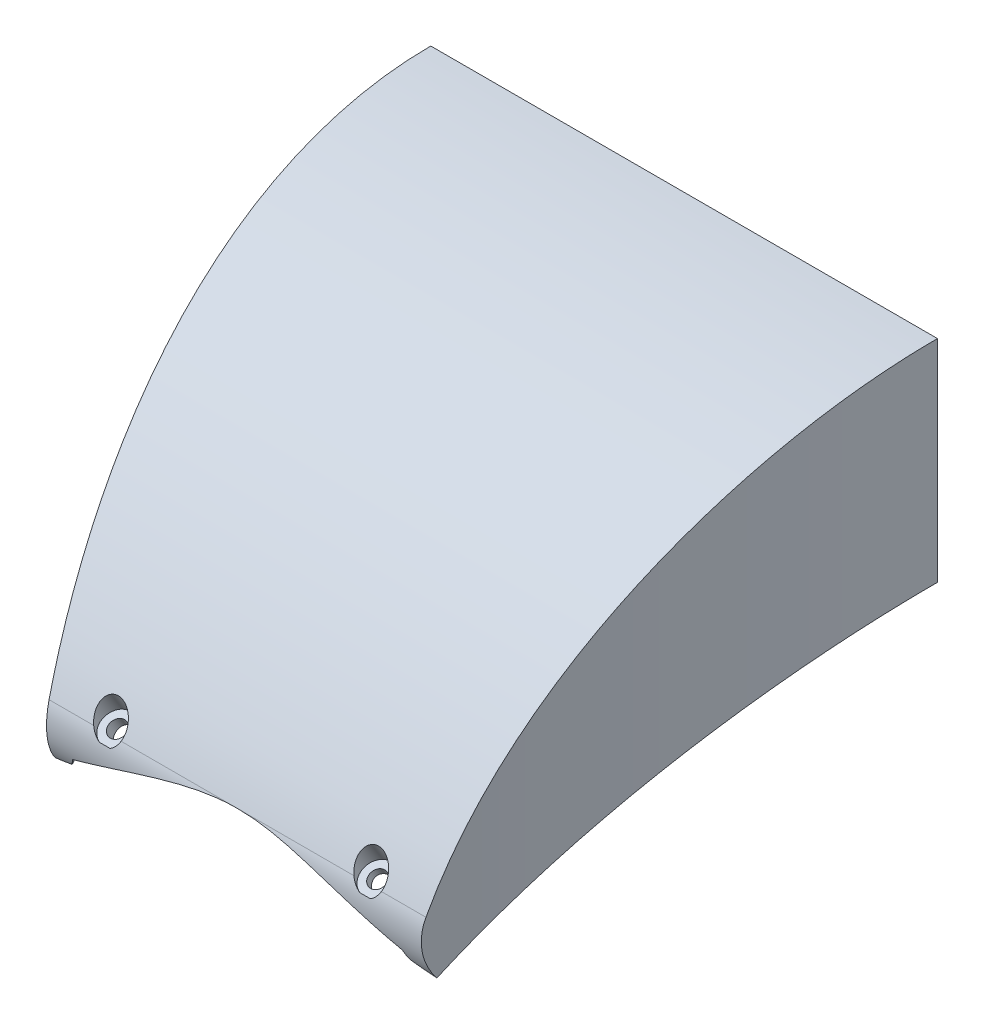
from build123d import *

# Parameters (mm, degrees)
TOP_CUT_DEPTH                   = 223.111574312
TOP_CUT_DEPTH_BACK              = 223.111574312
SIDE_CUT_DEPTH                  = 196.608334623
SIDE_CUT_DEPTH_BACK             = 196.608334623
BOTTOM_CUT_REACH                = 196.677
BOTTOM_CUT_END_RADIUS           = 109.850014385
HOLE_START                      = -57.000000101
HOLE_TABS_DEPTH                 = 114.000000101
HOLE_START_2                    = 107.658333008
HOLE_TABS_2_DEPTH               = 38.341666992
SKETCH9_R                       = 2
REAR_HOLES_DEPTH                = 138.05974715
FRONT_HOLES_DEPTH               = 101.36697221
FRONT_HOLES_DEPTH_BACK          = 101.36697221
SKETCH13_R                      = 2
BOSS_EXTRUDE1_REACH             = 196.677
BOSS_EXTRUDE1_DIRECTION_2_REACH = 196.677
CUT_EXTRUDE30_DEPTH             = 195.677019765
CUT_EXTRUDE30_DEPTH_BACK        = 195.677019765
SKETCH17_R                      = 3.75
CUT_EXTRUDE31_DEPTH             = 100.46511077


with BuildPart() as part:
    # Body: sweep along a path in Sketch4
    with BuildLine(Plane(origin=(-60, 0, 0), x_dir=(0, 1, 0), z_dir=(-1, 0, 0))) as body_path:
        ThreePointArc((98.107084352, 0), (82.178849239, -63.884661696), (38.123020423, -112.81361653))
    # Sketch3 → Body (sweep)
    with BuildSketch(Plane.XY):
        with BuildLine():
            Line((-40, 107.819293264), (-39, 109.778185447))
            ThreePointArc((-39, 109.778185447), (0, 116.5), (39, 109.778185447))
            Line((39, 109.778185447), (40, 107.819293264))
            ThreePointArc((40, 107.819293264), (50.235264013, 103.447659468), (60, 98.107084352))
            Line((60, 98.107084352), (60, 148.107084352))
            Line((60, 148.107084352), (-60, 148.107084352))
            Line((-60, 148.107084352), (-60, 98.107084352))
            ThreePointArc((-60, 98.107084352), (-50.235264013, 103.447659468), (-40, 107.819293264))
        make_face()
    sweep(path=body_path.line)

    # Sketch5 → Top Cut (cut, two sides: drawn at the far end of the back side and taken through both)
    with BuildSketch(Plane.ZY.offset(-TOP_CUT_DEPTH_BACK)):
        with BuildLine():
            Line((154.265495158, 66.082665596), (112.81361653, 38.123020423))
            ThreePointArc((112.81361653, 38.123020423), (78.777227663, 116.060994057), (0, 148.107084352))
            ThreePointArc((0, 148.107084352), (87.358239835, 126.326228882), (154.265495158, 66.082665596))
        make_face()
    extrude(amount=TOP_CUT_DEPTH + TOP_CUT_DEPTH_BACK, mode=Mode.SUBTRACT)

    # Sketch6 → Side Cut (cut, two sides: drawn at the far end of the back side and taken through both)
    with BuildSketch(Plane(origin=(0, 0, 0), x_dir=(1, 0, 0), z_dir=(0, 1, 0)).offset(-SIDE_CUT_DEPTH_BACK)):
        with BuildLine():
            Line((-60, 0), (-60, -115.81361653))
            Line((-60, -115.81361653), (-41.487311586, -115.81361653))
            ThreePointArc((-41.487311586, -115.81361653), (-55.342635269, -58.641950441), (-60, 0))
        make_face()
        with BuildLine():
            Line((60, -115.81361653), (41.487311586, -115.81361653))
            ThreePointArc((41.487311586, -115.81361653), (55.342635269, -58.641950441), (60, 0))
            Line((60, 0), (60, -115.81361653))
        make_face()
    extrude(amount=SIDE_CUT_DEPTH + SIDE_CUT_DEPTH_BACK, mode=Mode.SUBTRACT)

    # Bottom Cut: up to this cylinder (the profile starts inside it)
    bottom_cut_end = Plane(origin=(0, 35.257069967, 0), z_dir=(1, 0, 0)) * Cylinder(BOTTOM_CUT_END_RADIUS, 614.054028769, mode=Mode.PRIVATE)
    # Sketch7 → Bottom Cut (cut, up to the surface)
    with BuildSketch(Plane(origin=(0, 0, 0), x_dir=(1, 0, 0), z_dir=(0, 1, 0)), mode=Mode.PRIVATE) as bottom_cut_sk1:
        with BuildLine():
            Line((-43, 0), (43, 0))
            Line((43, 0), (43, -10))
            Line((43, -10), (56.86429563, -10))
            ThreePointArc((56.86429563, -10), (53.132112911, -53.252179765), (44.339363468, -95.765328314))
            Line((44.339363468, -95.765328314), (-44.339363468, -95.765328314))
            ThreePointArc((-44.339363468, -95.765328314), (-53.132112911, -53.252179765), (-56.86429563, -10))
            Line((-56.86429563, -10), (-43, -10))
            Line((-43, -10), (-43, 0))
        make_face()
    bottom_cut_tool1 = extrude(bottom_cut_sk1.sketch, amount=BOTTOM_CUT_REACH, mode=Mode.PRIVATE) & bottom_cut_end
    add(bottom_cut_tool1.solids().sort_by_distance((0, 0, 47.139148))[0], mode=Mode.SUBTRACT)

    # Hole Tabs: read off the stored shape, not the designer's step
    # Hole Tabs outline → Hole Tabs (cut)
    with BuildSketch(Plane(origin=(0, 0, 0), x_dir=(0, 0, -1), z_dir=(1, 0, 0)).offset(HOLE_START)):
        with BuildLine():
            Line((-10, 107.658333008), (0, 107.658333008))
            Line((0, 107.658333008), (0, 145.107084352))
            ThreePointArc((0, 145.107084352), (-5.005198275, 144.992996858), (-10, 144.650971353))
            Line((-10, 144.650971353), (-10, 107.658333008))
        make_face()
    extrude(amount=HOLE_TABS_DEPTH, mode=Mode.SUBTRACT)

    # Hole Tabs 2 outline → Hole Tabs 2 (add)
    with BuildSketch(Plane(origin=(0, 0, 0), x_dir=(1, 0, 0), z_dir=(0, 1, 0)).offset(HOLE_START_2)):
        with BuildLine():
            Line((-57.000000101, -10), (-56.86429563, -10))
            ThreePointArc((-56.86429563, -10), (-56.966072346, -5.000460371), (-57, 0))
            Line((-57, 0), (-57.000000101, -10))
        make_face()
        with BuildLine():
            Line((57, -10), (57, 0))
            ThreePointArc((57, 0), (56.966072346, -5.000460371), (56.86429563, -10))
            Line((56.86429563, -10), (57, -10))
        make_face()
    extrude(amount=HOLE_TABS_2_DEPTH)

    # Sketch9 → Rear Holes (cut, through all)
    with BuildSketch(Plane(origin=(0, 107.658333008, 0), x_dir=(1, 0, 0), z_dir=(0, 1, 0))):
        with Locations(Location((-50, -5, 0), (0, 0, 270))):
            Circle(SKETCH9_R)
        with Locations(Location((50, -5, 0), (0, 0, 122.910049915))):
            Circle(SKETCH9_R)
    extrude(amount=-REAR_HOLES_DEPTH, mode=Mode.SUBTRACT)

    # Sketch13 → Front Holes (cut, two sides: drawn at the far end of the back side and taken through both)
    with BuildSketch(Plane(origin=(0, 93.060427843, 58.680445491), x_dir=(1, 0, 0), z_dir=(0, 0.8458767409289836, 0.5333784202190422)).offset(-FRONT_HOLES_DEPTH_BACK)):
        with Locations(Location((-30.81571483, -47.795578877, 0), (0, 0, 270))):
            Circle(SKETCH13_R)
        with Locations(Location((30.81571483, -47.795578877, 0), (0, 0, 270))):
            Circle(SKETCH13_R)
    extrude(amount=FRONT_HOLES_DEPTH + FRONT_HOLES_DEPTH_BACK, mode=Mode.SUBTRACT)

    # Sketch14 → Boss-Extrude1 (add, up to next)
    with BuildSketch(Plane(origin=(0, 0, 0), x_dir=(0, 0, -1), z_dir=(1, 0, 0)), mode=Mode.PRIVATE) as boss_extrude1_sk1:
        with BuildLine():
            Line((0, 107.658333008), (-10, 107.658333008))
            ThreePointArc((-10, 107.658333008), (-54.508774834, 101.58696937), (-95.765328314, 83.816508246))
            Line((-95.765328314, 83.816508246), (-95.765328314, 83.232438151))
            ThreePointArc((-95.765328314, 83.232438151), (-54.520051621, 101.064803392), (-10, 107.158333008))
            Line((-10, 107.158333008), (0, 107.158333008))
            Line((0, 107.158333008), (0, 107.658333008))
        make_face()
    boss_extrude1_tool1 = extrude(boss_extrude1_sk1.sketch, amount=BOSS_EXTRUDE1_REACH, mode=Mode.PRIVATE) - part.part
    add(boss_extrude1_tool1.solids().sort_by_distance((0, 107.257164, 5))[0])

    # Sketch14 → Boss-Extrude1 direction 2 (add, up to next)
    with BuildSketch(Plane(origin=(0, 0, 0), x_dir=(0, 0, -1), z_dir=(1, 0, 0)), mode=Mode.PRIVATE) as boss_extrude1_direction_2_sk1:
        with BuildLine():
            Line((0, 107.658333008), (-10, 107.658333008))
            ThreePointArc((-10, 107.658333008), (-54.508774834, 101.58696937), (-95.765328314, 83.816508246))
            Line((-95.765328314, 83.816508246), (-95.765328314, 83.232438151))
            ThreePointArc((-95.765328314, 83.232438151), (-54.520051621, 101.064803392), (-10, 107.158333008))
            Line((-10, 107.158333008), (0, 107.158333008))
            Line((0, 107.158333008), (0, 107.658333008))
        make_face()
    boss_extrude1_direction_2_tool1 = extrude(boss_extrude1_direction_2_sk1.sketch, amount=-BOSS_EXTRUDE1_DIRECTION_2_REACH, mode=Mode.PRIVATE) - part.part
    add(boss_extrude1_direction_2_tool1.solids().sort_by_distance((0, 107.257164, 5))[0])

    # Sketch16 → Cut-Extrude30 (cut, two sides: drawn at the far end of the back side and taken through both)
    with BuildSketch(Plane(origin=(0, 0, 0), x_dir=(0, 0, -1), z_dir=(1, 0, 0)).offset(-CUT_EXTRUDE30_DEPTH_BACK)):
        with BuildLine():
            Line((-103.765328256, 61.453205115), (-103.765328256, 48.841149681))
            Line((-103.765328256, 48.841149681), (-113.555025046, 48.841149681))
            Line((-113.555025046, 48.841149681), (-113.555025046, 74.612134261))
            Line((-113.555025046, 74.612134261), (-105.765328256, 74.612134261))
            ThreePointArc((-105.765328256, 74.612134261), (-106.470095482, 67.773565439), (-103.765328256, 61.453205115))
        make_face()
    extrude(amount=CUT_EXTRUDE30_DEPTH + CUT_EXTRUDE30_DEPTH_BACK, mode=Mode.SUBTRACT)

    # Sketch17 → Cut-Extrude31 (cut, through all)
    with BuildSketch(Plane(origin=(0, 99.827441771, 62.947472852), x_dir=(1, 0, 0), z_dir=(0, 0.8458767409289836, 0.5333784202190422))):
        with Locations((-30.81571483, -47.795578877)):
            Circle(SKETCH17_R)
        with Locations((30.81571483, -47.795578877)):
            Circle(SKETCH17_R)
    extrude(amount=CUT_EXTRUDE31_DEPTH, mode=Mode.SUBTRACT)


solid = part.part
